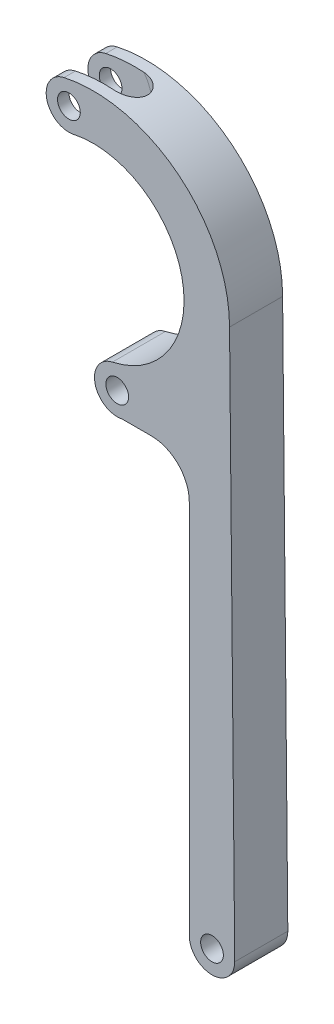
from build123d import *

# Parameters (mm, degrees)
CROQUIS1_R              = 6
CROQUIS1_R_2            = 3
SALIENTE_EXTRUIR1_DEPTH = 14
CORTAR_EXTRUIR1_START   = -3
CROQUIS3_R              = 15
CORTAR_EXTRUIR1_DEPTH   = 8
REDONDEO1_R             = 4


with BuildPart() as part:
    # Croquis1 → Saliente-Extruir1 (new body)
    # profile 1 of 5: a face of its own
    with BuildSketch(Plane.XY):
        with BuildLine():
            ThreePointArc((-23.725422134, 109.136941816), (-3.343361872, 121.724461131), (4.62711067, 144.315290918))
            ThreePointArc((4.62711067, 144.315290918), (-8.782059543, 172.344818376), (-39.020356526, 179.493640019))
            ThreePointArc((-39.020356526, 179.493640019), (-33.980640362, 178.302169745), (-31.74577866, 173.630581835))
            ThreePointArc((-31.74577866, 173.630581835), (-33.07419075, 169.865443538), (-36.471200794, 167.767523652))
            ThreePointArc((-36.471200794, 167.767523652), (-7.920656596, 149.413602382), (-26.274577866, 120.863058184))
            ThreePointArc((-26.274577866, 120.863058184), (-21.234861702, 119.67158791), (-19, 115))
            ThreePointArc((-19, 115), (-20.32841209, 111.234861702), (-23.725422134, 109.136941816))
        make_face()
    # profile 2 of 5: a face of its own
    with BuildSketch(Plane.XY):
        with Locations((-37.74577866, 173.630581835)):
            Circle(CROQUIS1_R)
        with Locations((-37.74577866, 173.630581835)):
            Circle(CROQUIS1_R_2, mode=Mode.SUBTRACT)
    # profile 3 of 5: a face of its own
    with BuildSketch(Plane.XY):
        with Locations((-25, 115)):
            Circle(CROQUIS1_R)
        with Locations((-25, 115)):
            Circle(CROQUIS1_R_2, mode=Mode.SUBTRACT)
    # profile 4 of 5: a face of its own
    with BuildSketch(Plane.XY):
        with BuildLine():
            Line((5.998914104, 0.114147164), (4.62711067, 144.315290918))
            ThreePointArc((4.62711067, 144.315290918), (-3.343361872, 121.724461131), (-23.725422134, 109.136941816))
            Line((-23.725422134, 109.136941816), (-16, 109.136941816))
            ThreePointArc((-16, 109.136941816), (-8.928932188, 106.208009628), (-6, 99.136941816))
            Line((-6, 99.136941816), (-6, 0))
            ThreePointArc((-6, 0), (-0.057076164, 5.99972852), (5.998914104, 0.114147164))
        make_face()
    # profile 5 of 5: a face of its own
    with BuildSketch(Plane.XY):
        with BuildLine():
            Line((6, 0), (5.998914104, 0.114147164))
            ThreePointArc((5.998914104, 0.114147164), (-0.057076164, 5.99972852), (-6, 0))
            ThreePointArc((-6, 0), (0, -6), (6, 0))
        make_face()
        Circle(CROQUIS1_R_2, mode=Mode.SUBTRACT)
    extrude(amount=SALIENTE_EXTRUIR1_DEPTH)

    # Croquis3 → Cortar-Extruir1 (cut)
    with BuildSketch(Plane.XY.offset(14).offset(CORTAR_EXTRUIR1_START)):
        with Locations((-37.74577866, 173.630581835)):
            Circle(CROQUIS3_R)
    extrude(amount=-CORTAR_EXTRUIR1_DEPTH, mode=Mode.SUBTRACT)

    # Redondeo1
    redondeo1_edges = [part.edges().sort_by_distance(p)[0] for p in [
        (-22.748314626, 173.3547693, 11),
        (-22.748314626, 173.3547693, 3),
    ]]
    fillet(redondeo1_edges, radius=REDONDEO1_R - 0.0001)  # a hair under: the kernel refuses the full size


solid = part.part
